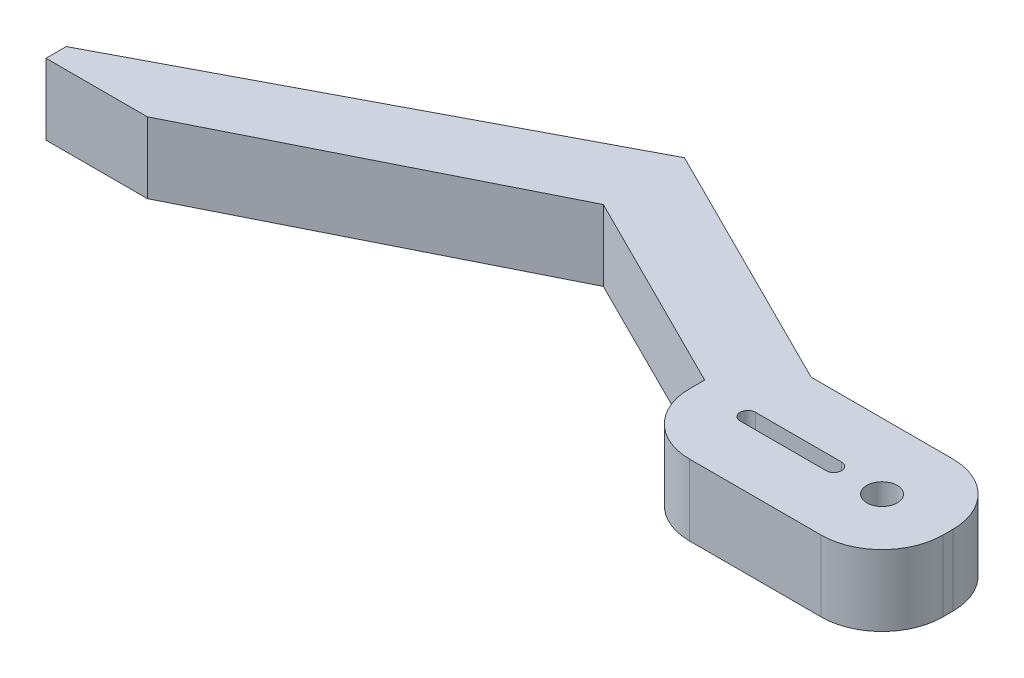
from build123d import *

# Parameters (mm, degrees)
SKETCH1_W                = 25
SKETCH1_H                = 13
BOSS_EXTRUDE1_DEPTH      = 7
F_3_0_3_DIAMETER_HOLE3_D = 3
FILLET7_R                = 6
CUT_EXTRUDE1_DEPTH       = 52.019604075
FILLET8_R                = 0.75


with BuildPart() as part:
    # Sketch1 → Boss-Extrude1 (new body)
    with BuildSketch(Plane(origin=(0, 0, 0), x_dir=(1, 0, 0), z_dir=(0, 1, 0))):
        Polygon((-40, 0), (-30, 0), (0, 15), (20, 5), (20, 10.5), (25, 10.5), (0, 23), (-40, 2), align=None)
        with Locations((32.5, 4)):
            Rectangle(SKETCH1_W, SKETCH1_H)
    extrude(amount=BOSS_EXTRUDE1_DEPTH)

    # Ø3.0 (3) Diameter Hole3 (through all)
    with Locations(Plane(origin=(0, 7, 0), x_dir=(1, 0, 0), z_dir=(0, 1, 0))):
        with Locations((38.5, 4)):
            Hole(F_3_0_3_DIAMETER_HOLE3_D / 2)

    # Fillet7
    fillet7_edges = [part.edges().sort_by_distance(p)[0] for p in [
        (20, 3.5, 2.5),
        (45, 3.5, 2.5),
        (45, 3.5, -10.5),
    ]]
    fillet(fillet7_edges, radius=FILLET7_R)

    # Sketch11 → Cut-Extrude1 (cut, through all)
    with BuildSketch(Plane(origin=(0, 7, 0), x_dir=(1, 0, 0), z_dir=(0, 1, 0))):
        Polygon((24.5, 4), (24.5, 3.25), (34.5, 3.25), (34.5, 4.75), (24.5, 4.75), align=None)
    extrude(amount=-CUT_EXTRUDE1_DEPTH, mode=Mode.SUBTRACT)

    # Fillet8
    fillet8_edges = [part.edges().sort_by_distance(p)[0] for p in [
        (34.5, 3.5, -3.25),
        (34.5, 3.5, -4.75),
        (24.5, 3.5, -4.75),
        (24.5, 3.5, -3.25),
    ]]
    fillet(fillet8_edges, radius=FILLET8_R - 0.0001)  # a hair under: the kernel refuses the full size


solid = part.part
